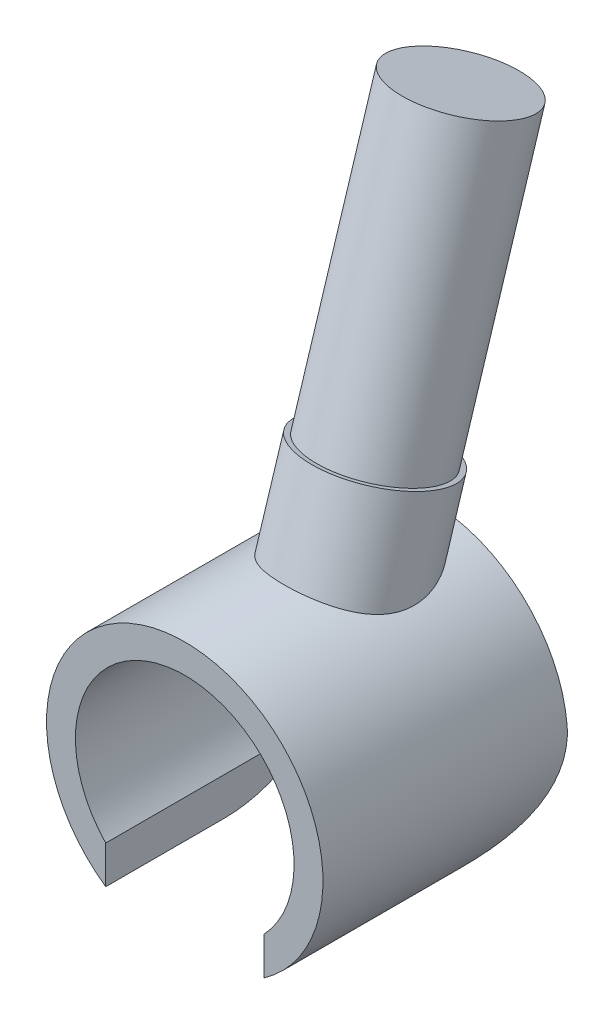
from build123d import *

# Parameters (mm, degrees)
BOSS_EXTRUDE1_DEPTH      = 4.32
BOSS_EXTRUDE2_REACH      = 14.287
BOSS_EXTRUDE2_END_RADIUS = 2.44
SKETCH4_R                = 1.08
BOSS_EXTRUDE3_REACH      = 19.377
BOSS_EXTRUDE3_END_RADIUS = 2.44
BOSS_EXTRUDE3_START      = -5.090003587
SKETCH4_3_R              = 1.17
SKETCH4_3_R_2            = 1.08
CUT_EXTRUDE1_DEPTH       = 11.155444579
CUT_EXTRUDE1_DEPTH_BACK  = 11.155444579


with BuildPart() as part:
    # Sketch1 → Boss-Extrude1 (new body)
    with BuildSketch(Plane.XY):
        with BuildLine():
            Line((-1.395, -1.333744728), (-1.395, -2.001892854))
            ThreePointArc((-1.395, -2.001892854), (0, 2.44), (1.395, -2.001892854))
            Line((1.395, -2.001892854), (1.395, -1.333744728))
            ThreePointArc((1.395, -1.333744728), (0, 1.93), (-1.395, -1.333744728))
        make_face()
    extrude(amount=BOSS_EXTRUDE1_DEPTH)

    # Boss-Extrude2: up to this cylinder (the profile starts outside it)
    boss_extrude2_end = Plane(origin=(0, 0, -0.552791), z_dir=(0, 0, -1)) * Cylinder(BOSS_EXTRUDE2_END_RADIUS, 34.454, mode=Mode.PRIVATE)
    # Sketch4 → Boss-Extrude2 (add, up to the surface)
    with BuildSketch(Plane(origin=(0, 7.942508478, -2.472295287), x_dir=(1, 0, 0), z_dir=(0, 0.9548126866673511, -0.29720823235414445)), mode=Mode.PRIVATE) as boss_extrude2_sk1:
        with Locations((0, -2.010346474)):
            Circle(SKETCH4_R)
    boss_extrude2_tool1 = extrude(boss_extrude2_sk1.sketch, amount=-BOSS_EXTRUDE2_REACH, mode=Mode.PRIVATE) - boss_extrude2_end
    add(boss_extrude2_tool1.solids().sort_by_distance((0, 8.54, -0.552791))[0])

    # Boss-Extrude3: up to this cylinder (the profile starts outside it)
    boss_extrude3_end = Plane(origin=(0, 0, 0.96), z_dir=(0, 0, -1)) * Cylinder(BOSS_EXTRUDE3_END_RADIUS, 44.634, mode=Mode.PRIVATE)
    # Sketch4<3> → Boss-Extrude3 (add, up to the surface)
    with BuildSketch(Plane(origin=(0, 7.942508478, -2.472295287), x_dir=(1, 0, 0), z_dir=(0, 0.9548126866673511, -0.29720823235414445)).offset(BOSS_EXTRUDE3_START), mode=Mode.PRIVATE) as boss_extrude3_sk1:
        with Locations((0, -2.010346474)):
            Circle(SKETCH4_3_R)
        with Locations((0, -2.010346474)):
            Circle(SKETCH4_3_R_2, mode=Mode.SUBTRACT)
    boss_extrude3_tool1 = extrude(boss_extrude3_sk1.sketch, amount=-BOSS_EXTRUDE3_REACH, mode=Mode.PRIVATE) - boss_extrude3_end
    add(boss_extrude3_tool1.solids().sort_by_distance((-1.136907, 3.68, 0.96))[0])

    # Sketch2 → Cut-Extrude1 (cut, two sides: drawn at the far end of the back side and taken through both)
    with BuildSketch(Plane(origin=(0, 0, 0), x_dir=(0, 0, -1), z_dir=(1, 0, 0)).offset(-CUT_EXTRUDE1_DEPTH_BACK)):
        with BuildLine():
            Line((0, -2.001892854), (0, 0.218107146))
            ThreePointArc((0, 0.218107146), (-0.650222946, -1.351669909), (-2.22, -2.001892854))
            Line((-2.22, -2.001892854), (0, -2.001892854))
        make_face()
    extrude(amount=CUT_EXTRUDE1_DEPTH + CUT_EXTRUDE1_DEPTH_BACK, mode=Mode.SUBTRACT)


solid = part.part
